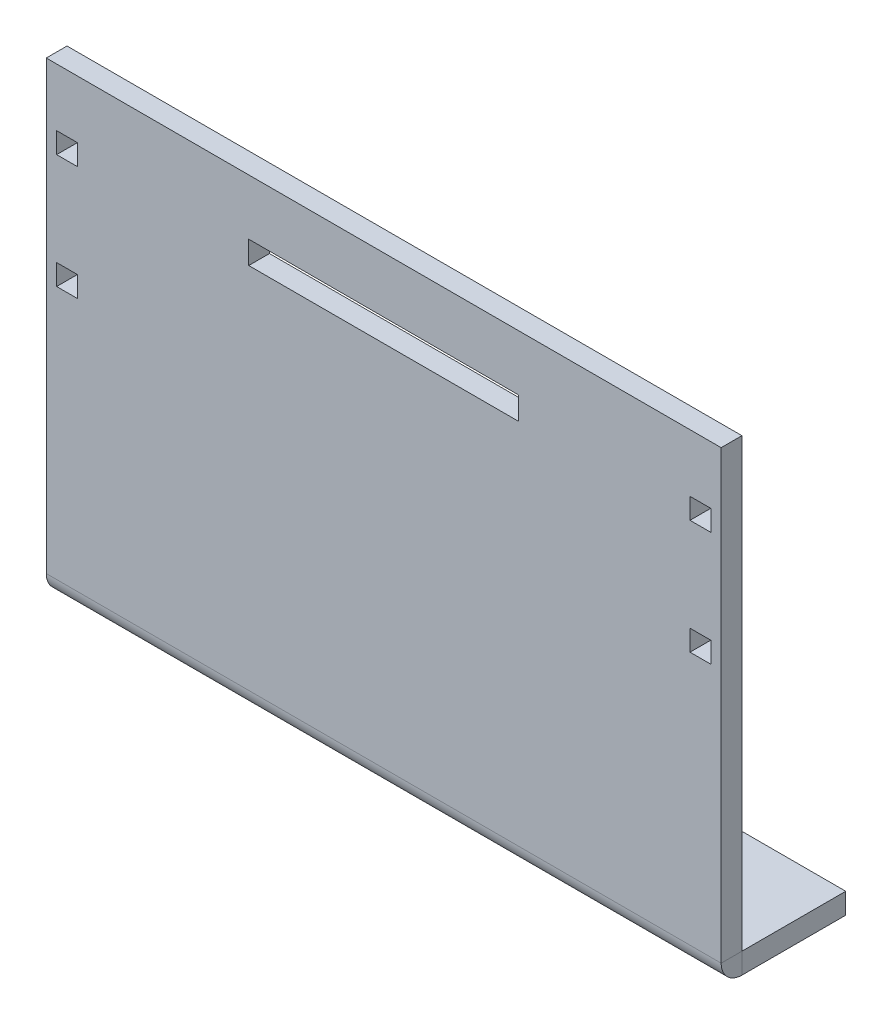
from build123d import *

# Parameters (mm, degrees)
SKETCH_1_W                   = 65
SKETCH_1_H                   = 45
SM_BASE_FLANGE_1_DEPTH       = 2
SM_START                     = -32.425287356
SM_EDGE_FLANGE_1_DEPTH       = 65
SM_EDGE_FLANGE_1_2_OUTLINE_W = 2
SM_EDGE_FLANGE_1_2_OUTLINE_H = 10
SM_EDGE_FLANGE_1_2_DEPTH     = 65
SKETCH_9_W                   = 2
SKETCH_9_H                   = 2
SKETCH_9_W_2                 = 26
SKETCH_9_H_2                 = 2.2
CUT_EXTRUDE_1_DEPTH          = 10
SKETCH_11_R                  = 1.65
CUT_EXTRUDE_3_DEPTH          = 10


# Read off the part's stored shape, not the designer's step: 边线-法兰1
# Sheet-metal steps are written as plain solids
with BuildPart() as part:
    # Sketch 1 → 基体-法兰1 (new body)
    with BuildSketch(Plane.XY):
        with Locations((0.074712644, -3.939027096)):
            Rectangle(SKETCH_1_W, SKETCH_1_H)
    extrude(amount=-SM_BASE_FLANGE_1_DEPTH)

    # 边线-法兰1 outline → 边线-法兰1 (cut)
    with BuildSketch(Plane.YZ.offset(SM_START)):
        with BuildLine():
            ThreePointArc((-26.439027096, -2), (-25.853240658, -0.585786437), (-24.439027096, 0))
            Line((-24.439027096, 0), (-26.439027096, 0))
            Line((-26.439027096, 0), (-26.439027096, -2))
        make_face()
    extrude(amount=SM_EDGE_FLANGE_1_DEPTH, mode=Mode.SUBTRACT)

    # Sm Edge Flange 1 2 outline → Sm Edge Flange 1 2 (add)
    with BuildSketch(Plane.YZ.offset(SM_START)):
        with Locations((-25.439027096, -7)):
            Rectangle(SM_EDGE_FLANGE_1_2_OUTLINE_W, SM_EDGE_FLANGE_1_2_OUTLINE_H)
    extrude(amount=SM_EDGE_FLANGE_1_2_DEPTH)

    # 草图9 → 切除-拉伸1 (cut)
    with BuildSketch(Plane.XY):
        with Locations((-30.425287356, 1)):
            Rectangle(SKETCH_9_W, SKETCH_9_H)
        with Locations((0.074712644, 12.1)):
            Rectangle(SKETCH_9_W_2, SKETCH_9_H_2)
        with Locations((30.574712644, 12)):
            Rectangle(SKETCH_9_W, SKETCH_9_H)
        with Locations((-30.425287356, 12)):
            Rectangle(SKETCH_9_W, SKETCH_9_H)
        with Locations((30.574712644, 1)):
            Rectangle(SKETCH_9_W, SKETCH_9_H)
    extrude(amount=-CUT_EXTRUDE_1_DEPTH, mode=Mode.SUBTRACT)

    # 草图11 → 切除-拉伸3 (cut)
    with BuildSketch(Plane(origin=(0, -24.439027096, 0), x_dir=(1, 0, 0), z_dir=(0, 1, 0))):
        with Locations(Location((-22.925287356, 7, 0), (0, 0, 270))):
            Circle(SKETCH_11_R)
        with Locations(Location((23.074712644, 7, 0), (0, 0, 90))):
            Circle(SKETCH_11_R)
    extrude(amount=-CUT_EXTRUDE_3_DEPTH, mode=Mode.SUBTRACT)


solid = part.part
